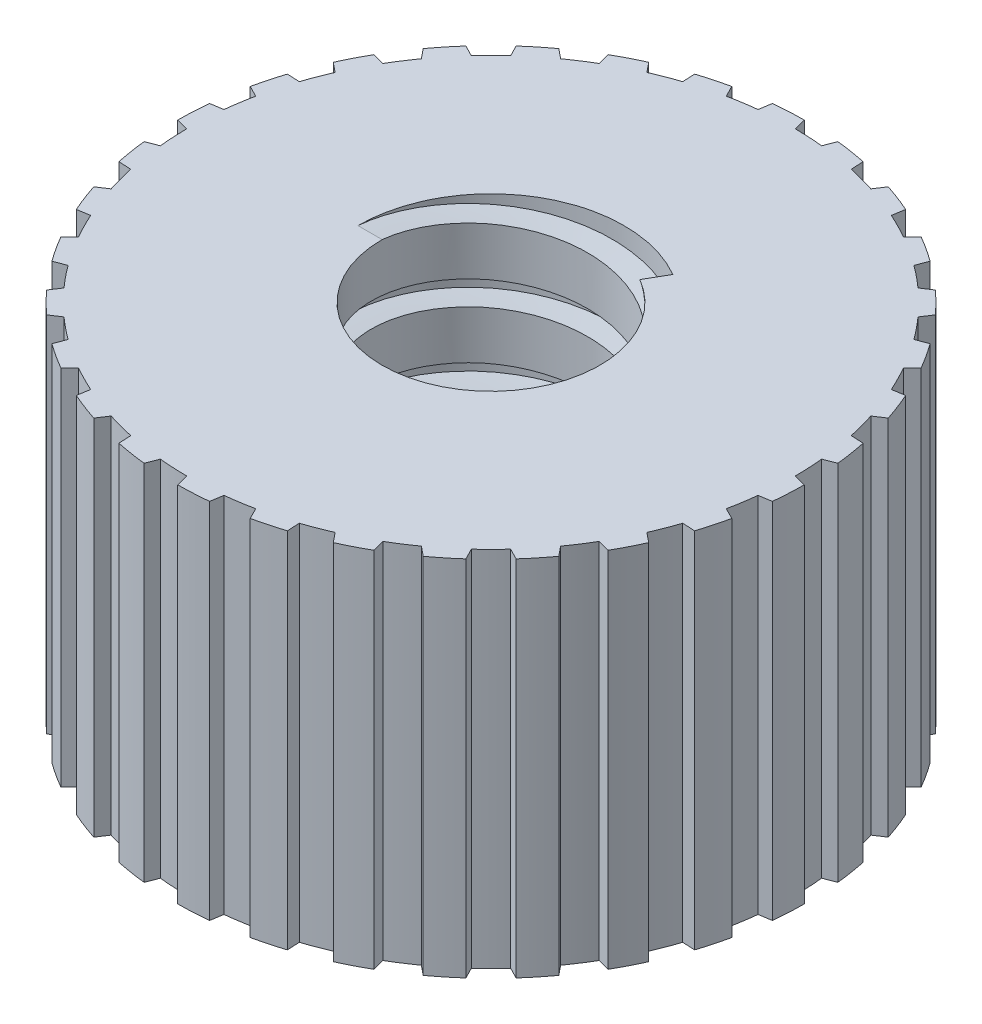
from build123d import *

# Parameters (mm, degrees)
SKETCH1_R           = 13
SKETCH1_R_2         = 4.5
BOSS_EXTRUDE1_DEPTH = 15
CUT_SWEEP1_PITCH    = 3
CUT_EXTRUDE2_DEPTH  = 24.727621208
CIRPATTERN1_COUNT   = 30


with BuildPart() as part:
    # Sketch1 → Boss-Extrude1 (new body)
    with BuildSketch(Plane(origin=(0, 0, 0), x_dir=(1, 0, 0), z_dir=(0, 1, 0))):
        with Locations(Location((0, 0, 0), (0, 0, 270))):
            Circle(SKETCH1_R)
        with Locations(Location((0, 0, 0), (0, 0, 270))):
            Circle(SKETCH1_R_2, mode=Mode.SUBTRACT)
    extrude(amount=BOSS_EXTRUDE1_DEPTH)

    # Cut-Sweep1: arcs per turn and ends read off the stored shape
    # Cut-Sweep1: the profile of Sketch7 profile screwed along a right-hand helix through 6.6 turns, 10 arcs to a turn; built about Z, then put on its axis
    cut_sweep1_z = Axis((0, 0, 0), (0, 0, 1))
    cut_sweep1_corners = [(4.4997, 0, -3), (4.4997, 0, -2), (5.5, 0, -2), (5.5, 0, -3)]
    with BuildLine(mode=Mode.PRIVATE) as cut_sweep1_profile:
        Line(cut_sweep1_corners[0], cut_sweep1_corners[1])
        Line(cut_sweep1_corners[1], cut_sweep1_corners[2])
        Line(cut_sweep1_corners[2], cut_sweep1_corners[3])
        Line(cut_sweep1_corners[3], cut_sweep1_corners[0])
    cut_sweep1_cap = Face(cut_sweep1_profile.wire())
    cut_sweep1_turn_angles = [0, 18, 36, 54, 72, 90, 108, 126, 144, 162, 180, 198, 216, 234, 252, 270, 288, 306, 324, 342, 360]
    cut_sweep1_turn_weights = [1, 0.9510565162951535, 1, 0.9510565162951535, 1, 0.9510565162951535, 1, 0.9510565162951535, 1, 0.9510565162951535, 1, 0.9510565162951535, 1, 0.9510565162951535, 1, 0.9510565162951535, 1, 0.9510565162951535, 1, 0.9510565162951535, 1]
    cut_sweep1_turn_rails = [Edge.make_bspline([Vector(p[0], p[1], 0).rotate(cut_sweep1_z, cut_sweep1_turn_angles[k]) / cut_sweep1_turn_weights[k] + Vector(0, 0, p[2] + CUT_SWEEP1_PITCH * cut_sweep1_turn_angles[k] / 360) for k in range(21)], [0, 0, 0, 1, 1, 2, 2, 3, 3, 4, 4, 5, 5, 6, 6, 7, 7, 8, 8, 9, 9, 10, 10, 10], 2, cut_sweep1_turn_weights) for p in cut_sweep1_corners]
    cut_sweep1_turn_sides = [Face.make_surface_from_curves(cut_sweep1_turn_rails[p[0]], cut_sweep1_turn_rails[p[1]]) for p in [(0, 1), (1, 2), (2, 3), (3, 0)]]
    cut_sweep1_last_angles = [2160, 2178, 2196, 2214, 2232, 2250, 2268, 2286, 2304, 2322, 2340, 2358, 2376]
    cut_sweep1_last_weights = [1, 0.9510565162951535, 1, 0.9510565162951535, 1, 0.9510565162951535, 1, 0.9510565162951535, 1, 0.9510565162951535, 1, 0.9510565162951535, 1]
    cut_sweep1_last_rails = [Edge.make_bspline([Vector(p[0], p[1], 0).rotate(cut_sweep1_z, cut_sweep1_last_angles[k]) / cut_sweep1_last_weights[k] + Vector(0, 0, p[2] + CUT_SWEEP1_PITCH * cut_sweep1_last_angles[k] / 360) for k in range(13)], [0, 0, 0, 1, 1, 2, 2, 3, 3, 4, 4, 5, 5, 6, 6, 6], 2, cut_sweep1_last_weights) for p in cut_sweep1_corners]
    cut_sweep1_last_sides = [Face.make_surface_from_curves(cut_sweep1_last_rails[p[0]], cut_sweep1_last_rails[p[1]]) for p in [(0, 1), (1, 2), (2, 3), (3, 0)]]
    cut_sweep1 = Plane(origin=(0, 0, 0), x_dir=(-1, 0, 0), z_dir=(0, 1, 0)) * Solid(Shell([*[p.moved(Location((0, 0, CUT_SWEEP1_PITCH * i))) for i in range(6) for p in cut_sweep1_turn_sides], *cut_sweep1_last_sides, cut_sweep1_cap, cut_sweep1_cap.rotate(cut_sweep1_z, 2376).moved(Location((0, 0, CUT_SWEEP1_PITCH * 2376 / 360)))]))
    add(cut_sweep1, mode=Mode.SUBTRACT)

    # Sketch8 → Cut-Extrude2 (cut, through all)
    with BuildSketch(Plane(origin=(0, 15, 0), x_dir=(1, 0, 0), z_dir=(0, 1, 0))):
        with BuildLine():
            Line((0.080454134, 12.499741083), (-0.18721658, 13.498701788))
            ThreePointArc((-0.18721658, 13.498701788), (0.706535409, 13.481498719), (1.597189542, 13.405185025))
            Line((1.597189542, 13.405185025), (1.226565328, 12.43967594))
            ThreePointArc((1.226565328, 12.43967594), (0.654199453, 12.482869184), (0.080454134, 12.499741083))
        make_face()
    cut_extrude2 = extrude(amount=-CUT_EXTRUDE2_DEPTH, mode=Mode.SUBTRACT)

    # CirPattern1: Cut-Extrude2 ×30 about axis
    cirpattern1_axis = Axis((0, 0, 0), (0, 1, 0))
    for i in range(1, CIRPATTERN1_COUNT):
        add(cut_extrude2.rotate(cirpattern1_axis, i * 360 / CIRPATTERN1_COUNT), mode=Mode.SUBTRACT)


solid = part.part
